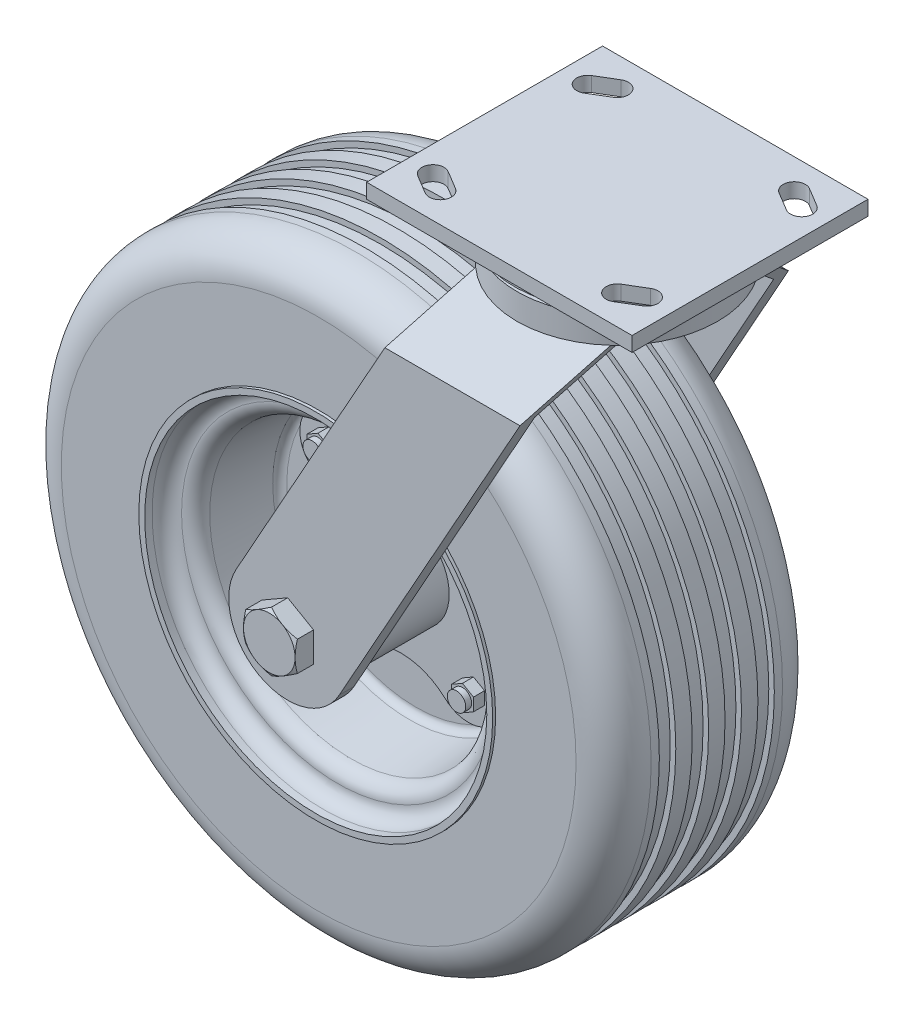
from build123d import *

# Parameters (mm, degrees)
SKETCH1_W               = 114.3
SKETCH1_H               = 6.35
BOSS_EXTRUDE1_DEPTH     = 50.8
F_1_2_HOLES_DEPTH       = 77.727341932
BOSS_EXTRUDE5_DEPTH     = 6.35
BOSS_EXTRUDE6_DEPTH     = 4.7625
SKETCH15_R              = 3.96875
BOSS_EXTRUDE7_DEPTH     = 2.54
SKETCH16_R              = 6.35
BOSS_EXTRUDE8_DEPTH     = 4.7625
SKETCH7_W               = 240.230526549
SKETCH7_H               = 115.57
BOSS_EXTRUDE2_DEPTH     = 277.6474
CUT_EXTRUDE1_START      = -115.57
CUT_EXTRUDE1_DEPTH      = 115.57
CUT_EXTRUDE3_DEPTH      = 272.433696387
CUT_EXTRUDE3_DEPTH_BACK = 272.433696387
SKETCH9_OUTSIDE_W       = 202.006
SKETCH9_OUTSIDE_H       = 391.236
BOSS_EXTRUDE3_DEPTH     = 7.9375
SKETCH11_OUTSIDE_W      = 1712.458
SKETCH11_OUTSIDE_H      = 1748.97
SKETCH11_OUTSIDE_R      = 11.1125
CUT_EXTRUDE4_DEPTH      = 391.814772653
CUT_EXTRUDE4_DRAFT      = -60
SKETCH12_R              = 10.795
BOSS_EXTRUDE4_DEPTH     = 102.87


# Read off the part's stored shape, not the designer's step: Cut-Extrude1
with BuildPart() as part:
    # Sketch1 → Boss-Extrude1 (new, symmetric)
    with BuildSketch(Plane.XY):
        with Locations((0, -3.175)):
            Rectangle(SKETCH1_W, SKETCH1_H)
    extrude(amount=BOSS_EXTRUDE1_DEPTH, both=True)

    # Sketch2 → 1-2 holes (cut, through all)
    with BuildSketch(Plane(origin=(0, 0, 0), x_dir=(1, 0, 0), z_dir=(0, 1, 0))):
        with BuildLine():
            Line((-35.649713965, 34.016189941), (-43.587213965, 29.253689941))
            ThreePointArc((-43.587213965, 29.253689941), (-50.121310059, 30.887213965), (-48.487786035, 37.421310059))
            Line((-48.487786035, 37.421310059), (-40.550286035, 42.183810059))
            ThreePointArc((-40.550286035, 42.183810059), (-34.016189941, 40.550286035), (-35.649713965, 34.016189941))
        make_face()
        with BuildLine():
            Line((-35.649713965, -34.016189941), (-43.587213965, -29.253689941))
            ThreePointArc((-43.587213965, -29.253689941), (-50.121310059, -30.887213965), (-48.487786035, -37.421310059))
            Line((-48.487786035, -37.421310059), (-40.550286035, -42.183810059))
            ThreePointArc((-40.550286035, -42.183810059), (-34.016189941, -40.550286035), (-35.649713965, -34.016189941))
        make_face()
        with BuildLine():
            Line((35.649713965, 34.016189941), (43.587213965, 29.253689941))
            ThreePointArc((43.587213965, 29.253689941), (50.121310059, 30.887213965), (48.487786035, 37.421310059))
            Line((48.487786035, 37.421310059), (40.550286035, 42.183810059))
            ThreePointArc((40.550286035, 42.183810059), (34.016189941, 40.550286035), (35.649713965, 34.016189941))
        make_face()
        with BuildLine():
            Line((35.649713965, -34.016189941), (43.587213965, -29.253689941))
            ThreePointArc((43.587213965, -29.253689941), (50.121310059, -30.887213965), (48.487786035, -37.421310059))
            Line((48.487786035, -37.421310059), (40.550286035, -42.183810059))
            ThreePointArc((40.550286035, -42.183810059), (34.016189941, -40.550286035), (35.649713965, -34.016189941))
        make_face()
    extrude(amount=-F_1_2_HOLES_DEPTH, mode=Mode.SUBTRACT)


with BuildPart() as body_2:
    # Sketch4 → Revolve1 (revolve)
    with BuildSketch(Plane.XY, mode=Mode.PRIVATE) as revolve1_sk:
        Polygon((0, -27.1526), (43.18, -27.1526), (43.18, -16.0401), (40.64, -16.0401), (40.64, -13.5001), (44.45, -13.5001), (44.45, -6.35), (0, -6.35), align=None)
    revolve(revolve1_sk.sketch.rotate(Axis((0, -6.35, 0), (0, -1, 0)), 180), axis=Axis((0, -6.35, 0), (0, -1, 0)))


with BuildPart() as body_3:
    # Sketch6 → Revolve2 (revolve)
    with BuildSketch(Plane(origin=(-84.1375, 0, 0), x_dir=(0, 0, -1), z_dir=(1, 0, 0)), mode=Mode.PRIVATE) as revolve2_sk:
        with BuildLine():
            Line((-44.45, -101.6), (-44.45, -66.963636364))
            ThreePointArc((-44.45, -66.963636364), (-39.715780518, -55.534219482), (-28.286363636, -50.8))
            Line((-28.286363636, -50.8), (-24.750568182, -50.8))
            Line((-24.750568182, -50.8), (-24.750568182, -53.18125))
            Line((-24.750568182, -53.18125), (-17.678977273, -53.18125))
            Line((-17.678977273, -53.18125), (-17.678977273, -50.8))
            Line((-17.678977273, -50.8), (-10.607386364, -50.8))
            Line((-10.607386364, -50.8), (-10.607386364, -53.18125))
            Line((-10.607386364, -53.18125), (-3.535795455, -53.18125))
            Line((-3.535795455, -53.18125), (-3.535795455, -50.8))
            Line((-3.535795455, -50.8), (3.535795455, -50.8))
            Line((3.535795455, -50.8), (3.535795455, -53.18125))
            Line((3.535795455, -53.18125), (10.607386364, -53.18125))
            Line((10.607386364, -53.18125), (10.607386364, -50.8))
            Line((10.607386364, -50.8), (17.678977273, -50.8))
            Line((17.678977273, -50.8), (17.678977273, -53.18125))
            Line((17.678977273, -53.18125), (24.750568182, -53.18125))
            Line((24.750568182, -53.18125), (24.750568182, -50.8))
            Line((24.750568182, -50.8), (28.286363636, -50.8))
            ThreePointArc((28.286363636, -50.8), (39.715780518, -55.534219482), (44.45, -66.963636364))
            Line((44.45, -66.963636364), (44.45, -101.6))
            Line((44.45, -101.6), (45.72, -101.6))
            Line((45.72, -101.6), (45.72, -104.14))
            Line((45.72, -104.14), (42.545, -104.14))
            ThreePointArc((42.545, -104.14), (38.054871939, -105.999871939), (36.195, -110.49))
            ThreePointArc((36.195, -110.49), (34.526711089, -114.779997818), (30.398438966, -116.815836333))
            Line((30.398438966, -116.815836333), (5.438280517, -118.999567237))
            ThreePointArc((5.438280517, -118.999567237), (3.374144456, -120.017486494), (2.54, -122.162485403))
            Line((2.54, -122.162485403), (2.54, -157.1625))
            Line((2.54, -157.1625), (45.72, -157.1625))
            Line((45.72, -157.1625), (48.895, -157.1625))
            Line((48.895, -157.1625), (48.895, -177.8))
            Line((48.895, -177.8), (-48.895, -177.8))
            Line((-48.895, -177.8), (-48.895, -157.1625))
            Line((-48.895, -157.1625), (-45.72, -157.1625))
            Line((-45.72, -157.1625), (-2.54, -157.1625))
            Line((-2.54, -157.1625), (-2.54, -122.162485403))
            ThreePointArc((-2.54, -122.162485403), (-3.374144456, -120.017486494), (-5.438280517, -118.999567237))
            Line((-5.438280517, -118.999567237), (-30.398438966, -116.815836333))
            ThreePointArc((-30.398438966, -116.815836333), (-34.526711089, -114.779997818), (-36.195, -110.49))
            ThreePointArc((-36.195, -110.49), (-38.054871939, -105.999871939), (-42.545, -104.14))
            Line((-42.545, -104.14), (-45.72, -104.14))
            Line((-45.72, -104.14), (-45.72, -101.6))
            Line((-45.72, -101.6), (-44.45, -101.6))
        make_face()
    revolve(revolve2_sk.sketch.rotate(Axis((-84.1375, -177.8, 111.145303652), (0, 0, -1)), 90), axis=Axis((-84.1375, -177.8, 111.145303652), (0, 0, -1)))

    # Sketch13 → Boss-Extrude5 (add)
    with BuildSketch(Plane.XY.offset(2.54)):
        with BuildLine():
            ThreePointArc((-123.854603847, -158.93239014), (-123.47916386, -138.45833614), (-103.00510986, -138.082896153))
            ThreePointArc((-103.00510986, -138.082896153), (-84.1375, -145.495828468), (-65.26989014, -138.082896153))
            ThreePointArc((-65.26989014, -138.082896153), (-44.79583614, -138.45833614), (-44.420396153, -158.93239014))
            ThreePointArc((-44.420396153, -158.93239014), (-51.833328468, -177.8), (-44.420396153, -196.66760986))
            ThreePointArc((-44.420396153, -196.66760986), (-44.79583614, -217.14166386), (-65.26989014, -217.517103847))
            ThreePointArc((-65.26989014, -217.517103847), (-84.1375, -210.104171532), (-103.00510986, -217.517103847))
            ThreePointArc((-103.00510986, -217.517103847), (-123.47916386, -217.14166386), (-123.854603847, -196.66760986))
            ThreePointArc((-123.854603847, -196.66760986), (-116.441671532, -177.8), (-123.854603847, -158.93239014))
        make_face()
    extrude(amount=BOSS_EXTRUDE5_DEPTH)

    # Sketch14 → Boss-Extrude6 (add)
    with BuildSketch(Plane.XY.offset(8.89)):
        Polygon((-115.229581305, -152.207180009), (-110.467081305, -149.457549352), (-110.467081305, -143.958288038), (-115.229581305, -141.208657381), (-119.992081305, -143.958288038), (-119.992081305, -149.457549352), align=None)
        Polygon((-48.282918695, -149.457549352), (-53.045418695, -152.207180009), (-57.807918695, -149.457549352), (-57.807918695, -143.958288038), (-53.045418695, -141.208657381), (-48.282918695, -143.958288038), align=None)
        Polygon((-53.045418695, -203.392819991), (-57.807918695, -206.142450648), (-57.807918695, -211.641711962), (-53.045418695, -214.391342619), (-48.282918695, -211.641711962), (-48.282918695, -206.142450648), align=None)
        Polygon((-119.992081305, -206.142450648), (-115.229581305, -203.392819991), (-110.467081305, -206.142450648), (-110.467081305, -211.641711962), (-115.229581305, -214.391342619), (-119.992081305, -211.641711962), align=None)
    extrude(amount=BOSS_EXTRUDE6_DEPTH)

    # Sketch15 → Boss-Extrude7 (add)
    with BuildSketch(Plane.XY.offset(13.6525)):
        with Locations((-115.229581305, -146.707918695)):
            Circle(SKETCH15_R)
        with Locations(Location((-53.045418695, -146.707918695, 0), (0, 0, 180))):
            Circle(SKETCH15_R)
        with Locations(Location((-115.229581305, -208.892081305, 0), (0, 0, 180))):
            Circle(SKETCH15_R)
        with Locations((-53.045418695, -208.892081305)):
            Circle(SKETCH15_R)
    extrude(amount=BOSS_EXTRUDE7_DEPTH)

    # Sketch16 → Boss-Extrude8 (add)
    with BuildSketch(Plane(origin=(0, 0, -2.54), x_dir=(-1, 0, 0), z_dir=(0, 0, -1))):
        with Locations(Location((53.045418695, -146.707918695, 0), (0, 0, 180))):
            Circle(SKETCH16_R)
        with Locations(Location((115.229581305, -146.707918695, 0), (0, 0, 180))):
            Circle(SKETCH16_R)
        with Locations(Location((115.229581305, -208.892081305, 0), (0, 0, 180))):
            Circle(SKETCH16_R)
        with Locations(Location((53.045418695, -208.892081305, 0), (0, 0, 180))):
            Circle(SKETCH16_R)
    extrude(amount=BOSS_EXTRUDE8_DEPTH)


with BuildPart() as body_4:
    # Sketch7 → Boss-Extrude2 (new body)
    with BuildSketch(Plane.XZ.offset(27.1526)):
        with Locations((-91.022236726, 0)):
            Rectangle(SKETCH7_W, SKETCH7_H)
    extrude(amount=BOSS_EXTRUDE2_DEPTH)

    # Cut-Extrude1 outline → Cut-Extrude1 (cut)
    with BuildSketch(Plane.XY.offset(57.785).offset(CUT_EXTRUDE1_START)):
        with BuildLine():
            Line((29.093026549, -27.1526), (-61.961739121, -190.185298923))
            ThreePointArc((-61.961739121, -190.185298923), (-96.522798923, -199.975760879), (-106.313260879, -165.414701077))
            Line((-106.313260879, -165.414701077), (-29.093026549, -27.1526))
            Line((-29.093026549, -27.1526), (-211.1375, -27.1526))
            Line((-211.1375, -27.1526), (-211.1375, -304.8))
            Line((-211.1375, -304.8), (29.093026549, -304.8))
            Line((29.093026549, -304.8), (29.093026549, -27.1526))
        make_face()
    extrude(amount=CUT_EXTRUDE1_DEPTH, mode=Mode.SUBTRACT)

    # Sketch9 outside → Cut-Extrude3 (cut, two sides: drawn at the far end of the back side and taken through both)
    with BuildSketch(Plane(origin=(0, -144.306693689, 0), x_dir=(0, 0, -1), z_dir=(-1, 0, 0)).offset(-CUT_EXTRUDE3_DEPTH_BACK)):
        with Locations((0, 8.093)):
            Rectangle(SKETCH9_OUTSIDE_W, SKETCH9_OUTSIDE_H)
        Polygon((57.785, 160.493306311), (57.785, -93.506693689), (31.90780792, -117.154093689), (25.55780792, -117.154093689), (51.435, -93.506693689), (51.435, 160.493306311), align=None, mode=Mode.SUBTRACT)
        Polygon((-25.55780792, -117.154093689), (-31.90780792, -117.154093689), (-57.785, -93.506693689), (-57.785, 160.493306311), (-51.435, 160.493306311), (-51.435, -93.506693689), align=None, mode=Mode.SUBTRACT)
    extrude(amount=CUT_EXTRUDE3_DEPTH + CUT_EXTRUDE3_DEPTH_BACK, mode=Mode.SUBTRACT)


with BuildPart() as cut_extrude3_piece_1:
    # of the separate pieces the step leaves, piece 1, a body of its own (cut_extrude3_pieces)
    add(body_4.part.solids().sort_by_distance((15.88580812, -50.8, 57.785))[0])



with BuildPart() as cut_extrude3_piece_2:
    # of the separate pieces the step leaves, piece 2, a body of its own (cut_extrude3_pieces)
    add(body_4.part.solids().sort_by_distance((29.093026549, -27.1526, -31.90780792))[0])


with BuildPart() as body_6:
    # Sketch10 → Boss-Extrude3 (new body)
    with BuildSketch(Plane.XY.offset(57.785)):
        Polygon((-84.1375, -164.968390267), (-95.25, -171.384195134), (-95.25, -184.215804866), (-84.1375, -190.631609733), (-73.025, -184.215804866), (-73.025, -171.384195134), align=None)
    extrude(amount=BOSS_EXTRUDE3_DEPTH)


with BuildPart() as cut_extrude4_tool:
    # Sketch11 outside → Cut-Extrude4 (with draft: the straight prism first)
    with BuildSketch(Plane.XY.offset(65.7225)):
        with Locations((-76.994, -152.4)):
            Rectangle(SKETCH11_OUTSIDE_W, SKETCH11_OUTSIDE_H)
        with Locations((-84.1375, -177.8)):
            Circle(SKETCH11_OUTSIDE_R, mode=Mode.SUBTRACT)
    extrude(amount=-CUT_EXTRUDE4_DEPTH)
    # Cut-Extrude4: the draft: its side faces are tilted about the plane it starts from
    cut_extrude4_sides = [cut_extrude4_tool.faces().sort_by_distance(p)[0] for p in [
        (-76.994, -1026.885, -130.184886326),
        (779.235, -152.4, -130.184886326),
        (-76.994, 722.085, -130.184886326),
        (-933.223, -152.4, -130.184886326),
        (-95.25, -177.8, -130.184886326),
    ]]
    draft(cut_extrude4_sides, Plane.XY.offset(65.7225), CUT_EXTRUDE4_DRAFT)


with BuildPart() as body_6_1:
    add(body_6.part)

    # Cut-Extrude4: cut by cut_extrude4_tool
    add(cut_extrude4_tool.part, mode=Mode.SUBTRACT)


with BuildPart() as body_7:
    # Mirror1: mirrored copy
    add(body_6_1.part.mirror(Plane.XY))


with BuildPart() as cut_extrude3_piece_1_1:
    add(cut_extrude3_piece_1.part)

    add(cut_extrude3_piece_2.part)  # Boss-Extrude4 merges Cut-Extrude3 piece 2
    # Sketch12 → Boss-Extrude4 (add)
    with BuildSketch(Plane.XY.offset(-51.435)):
        with Locations(Location((-84.1375, -177.8, 0), (0, 0, 180))):
            Circle(SKETCH12_R)
    extrude(amount=BOSS_EXTRUDE4_DEPTH)

    # Combine1: union body 7, body 6, body 2, part
    add(body_7.part)
    add(body_6_1.part)
    add(body_2.part)
    add(part.part)


solid = Compound([body_3.part, cut_extrude3_piece_1_1.part])
